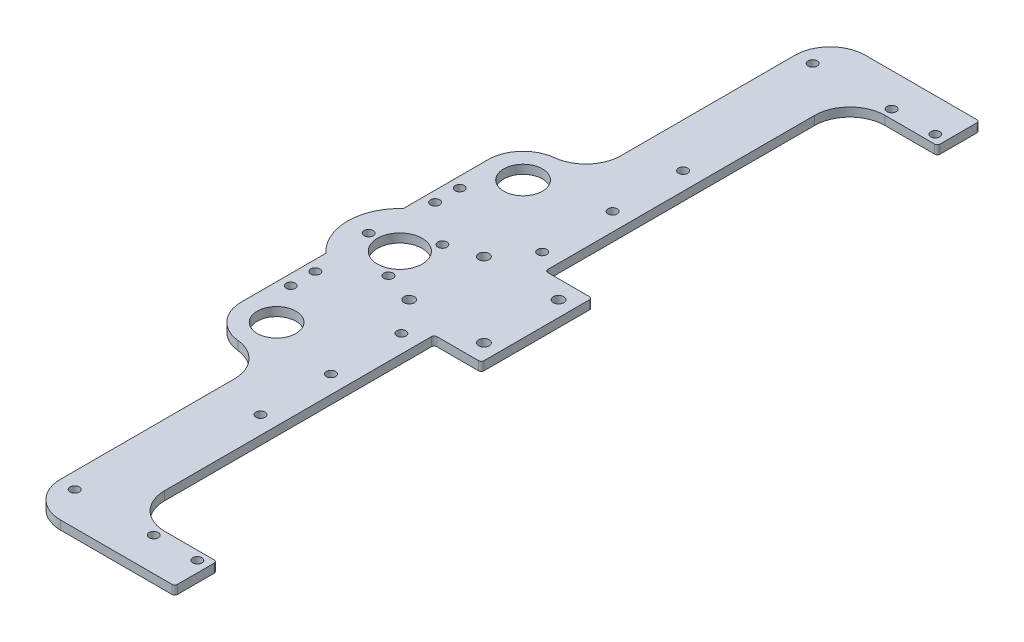
from build123d import *

# Parameters (mm, degrees)
SKETCH1_R           = 6.985
SKETCH1_R_2         = 1.6499967
SKETCH1_R_3         = 8.0645
BOSS_EXTRUDE1_DEPTH = 3.175
SKETCH4_R           = 1.65
CUT_EXTRUDE1_DEPTH  = 199.349545248
SKETCH5_R           = 1.89865
CUT_EXTRUDE2_DEPTH  = 199.349545248
FILLET1_R           = 1


with BuildPart() as part:
    # Sketch1 → Boss-Extrude1 (new body)
    with BuildSketch(Plane(origin=(0, 0, 0), x_dir=(1, 0, 0), z_dir=(0, 1, 0))):
        with BuildLine():
            ThreePointArc((-67.971311517, -24.866245744), (-74.128017531, -38.797272158), (-67.971311517, -52.728298572))
            Line((-67.971311517, -52.728298572), (-67.971311517, -82.586411585))
            ThreePointArc((-67.971311517, -82.586411585), (-64.941959488, -91.499608698), (-56.608448003, -95.878494725))
            ThreePointArc((-56.608448003, -95.878494725), (-48.492989851, -100.008926653), (-45.228378476, -108.509717293))
            Line((-45.228378476, -108.509717293), (-45.228378476, -171.249717293))
            ThreePointArc((-45.228378476, -171.249717293), (-41.508634597, -180.229973414), (-32.528378476, -183.949717293))
            Line((-32.528378476, -183.949717293), (7.398418219, -183.949717293))
            Line((7.398418219, -183.949717293), (8.682280525, -183.949717293))
            Line((8.682280525, -183.949717293), (8.682280525, -168.709717293))
            Line((8.682280525, -168.709717293), (-10.203517531, -168.709717293))
            ThreePointArc((-10.203517531, -168.709717293), (-19.183773652, -164.989973414), (-22.903517531, -156.009717293))
            Line((-22.903517531, -156.009717293), (-22.903517531, -58.797272158))
            Line((-22.903517531, -58.797272158), (-5.903517531, -58.797272158))
            Line((-5.903517531, -58.797272158), (-5.903517531, -38.797272158))
            Line((-5.903517531, -38.797272158), (-5.903517531, -18.797272158))
            Line((-5.903517531, -18.797272158), (-22.903517531, -18.797272158))
            Line((-22.903517531, -18.797272158), (-22.903517531, 78.415172977))
            ThreePointArc((-22.903517531, 78.415172977), (-19.183773652, 87.395429098), (-10.203517531, 91.115172977))
            Line((-10.203517531, 91.115172977), (8.682280525, 91.115172977))
            Line((8.682280525, 91.115172977), (8.682280525, 106.355172977))
            Line((8.682280525, 106.355172977), (-32.528378476, 106.355172977))
            ThreePointArc((-32.528378476, 106.355172977), (-41.508634597, 102.635429098), (-45.228378476, 93.655172977))
            Line((-45.228378476, 93.655172977), (-45.228378476, 30.915172977))
            ThreePointArc((-45.228378476, 30.915172977), (-48.492989851, 22.414382337), (-56.608448003, 18.28395041))
            ThreePointArc((-56.608448003, 18.28395041), (-64.941959488, 13.905064383), (-67.971311517, 4.991867269))
            Line((-67.971311517, 4.991867269), (-67.971311517, -24.866245744))
        make_face()
        with Locations((-55.288517531, -83.247272158)):
            Circle(SKETCH1_R, mode=Mode.SUBTRACT)
        with Locations((-64.161311517, -69.277272158)):
            Circle(SKETCH1_R_2, mode=Mode.SUBTRACT)
        with Locations((-64.161311517, -60.387272158)):
            Circle(SKETCH1_R_2, mode=Mode.SUBTRACT)
        with Locations((-66.528017531, -38.797272158)):
            Circle(SKETCH1_R_2, mode=Mode.SUBTRACT)
        with Locations((-55.288517531, -38.797272158)):
            Circle(SKETCH1_R_3, mode=Mode.SUBTRACT)
        with Locations((-49.668767531, -48.530964684)):
            Circle(SKETCH1_R_2, mode=Mode.SUBTRACT)
        with Locations((-29.342032123, -114.997272158)):
            Circle(SKETCH1_R_2, mode=Mode.SUBTRACT)
        with Locations((-29.342032123, -89.597272158)):
            Circle(SKETCH1_R_2, mode=Mode.SUBTRACT)
        with Locations((-29.342032123, -64.197272158)):
            Circle(SKETCH1_R_2, mode=Mode.SUBTRACT)
        with Locations((-64.161311517, -17.207272158)):
            Circle(SKETCH1_R_2, mode=Mode.SUBTRACT)
        with Locations((-64.161311517, -8.317272158)):
            Circle(SKETCH1_R_2, mode=Mode.SUBTRACT)
        with Locations((-55.288517531, 5.652727842)):
            Circle(SKETCH1_R, mode=Mode.SUBTRACT)
        with Locations((-49.668767531, -29.063579632)):
            Circle(SKETCH1_R_2, mode=Mode.SUBTRACT)
        with Locations((-29.342032123, -13.397272158)):
            Circle(SKETCH1_R_2, mode=Mode.SUBTRACT)
        with Locations((-29.342032123, 12.002727842)):
            Circle(SKETCH1_R_2, mode=Mode.SUBTRACT)
        with Locations((-29.342032123, 37.402727842)):
            Circle(SKETCH1_R_2, mode=Mode.SUBTRACT)
    extrude(amount=BOSS_EXTRUDE1_DEPTH)

    # Sketch4 → Cut-Extrude1 (cut, through all)
    with BuildSketch(Plane(origin=(0, 3.175, 0), x_dir=(1, 0, 0), z_dir=(0, 1, 0))):
        with Locations((4.753970241, 94.290172977)):
            Circle(SKETCH4_R)
        with Locations((-10.971029759, 94.290172977)):
            Circle(SKETCH4_R)
        with Locations((-39.471029759, 94.290172977)):
            Circle(SKETCH4_R)
        with Locations((-39.471029759, -171.884717293)):
            Circle(SKETCH4_R)
        with Locations((-10.971029759, -171.884717293)):
            Circle(SKETCH4_R)
        with Locations((4.753970241, -171.884717293)):
            Circle(SKETCH4_R)
    extrude(amount=-CUT_EXTRUDE1_DEPTH, mode=Mode.SUBTRACT)

    # Sketch5 → Cut-Extrude2 (cut, through all)
    with BuildSketch(Plane(origin=(0, 3.175, 0), x_dir=(1, 0, 0), z_dir=(0, 1, 0))):
        with Locations((-11.500645577, -25.326887976)):
            Circle(SKETCH5_R)
        with Locations((-38.441413941, -25.326887976)):
            Circle(SKETCH5_R)
        with Locations((-38.441413941, -52.267656339)):
            Circle(SKETCH5_R)
        with Locations((-11.500645577, -52.267656339)):
            Circle(SKETCH5_R)
    extrude(amount=-CUT_EXTRUDE2_DEPTH, mode=Mode.SUBTRACT)

    # Fillet1
    fillet1_edges = [part.edges().sort_by_distance(p)[0] for p in [
        (-22.903517531, 1.5875, 18.797272158),
        (-22.903517531, 1.5875, 58.797272158),
        (8.682280525, 1.5875, 183.949717293),
        (8.682280525, 1.5875, 168.709717293),
        (-5.903517531, 1.5875, 58.797272158),
        (-5.903517531, 1.5875, 18.797272158),
        (8.682280525, 1.5875, -106.355172977),
        (8.682280525, 1.5875, -91.115172977),
    ]]
    fillet(fillet1_edges, radius=FILLET1_R)


solid = part.part
